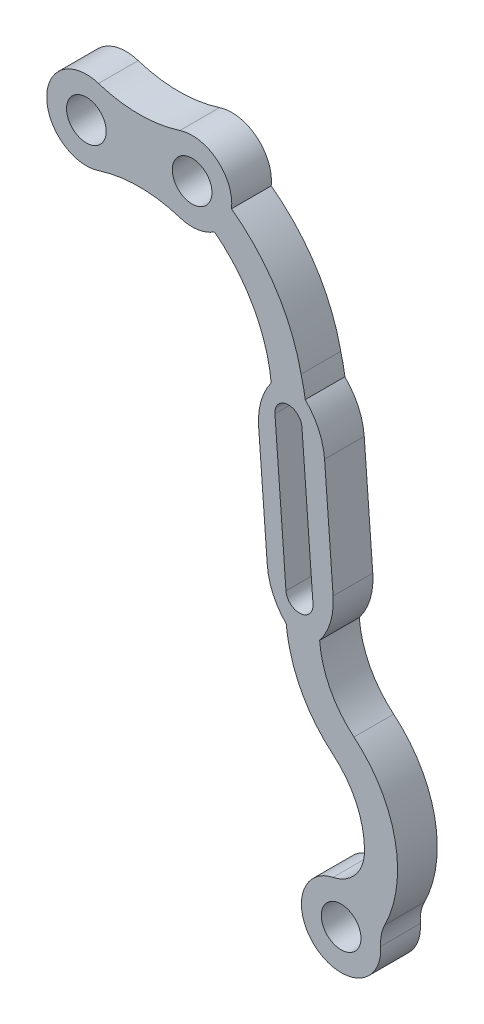
from build123d import *

# Parameters (mm, degrees)
BOSS_EXTRUDE1_OUTLINE_R = 1.5
BOSS_EXTRUDE1_DEPTH     = 3
FILLET1_R               = 5
CUT_EXTRUDE1_DEPTH      = 3


# Read off the part's stored shape, not the designer's step: Boss-Extrude1
with BuildPart() as part:
    # Boss-Extrude1 outline → Boss-Extrude1 (new body)
    with BuildSketch(Plane.XY):
        with BuildLine():
            ThreePointArc((-9.577975431, 41.29578544), (-7.088317742, 38.60475873), (-5.596455347, 35.255972867))
            add(Edge.make_bspline(
                [(-5.596455347, 35.255972867), (-5.582747417, 35.202444502), (-5.55529889, 35.095260217), (-5.517467472, 34.934551052), (-5.482131356, 34.775084793), (-5.449615345, 34.617937051), (-5.419947602, 34.464275495), (-5.393218029, 34.315238656), (-5.368054814, 34.162831666), (-5.344795736, 34.008181607), (-5.322858552, 33.847412998), (-5.30329297, 33.684837729), (-5.293582635, 33.591977311), (-5.288408722, 33.542498925)],
                knots=[0, 0, 0, 0, 0.07878117, 0.157750071, 0.236927243, 0.316333061, 0.395987726, 0.475911251, 0.556123446, 0.652047242, 0.7511991, 0.867432569, 1, 1, 1, 1], degree=3))
            Line((-5.288408722, 33.542498925), (-6.480466419, 33.453304935))
            Line((-6.480466419, 33.453304935), (-5.341603358, 18.232655185))
            Line((-5.341603358, 18.232655185), (-4.147731483, 18.321984917))
            ThreePointArc((-4.147731483, 18.321984917), (-4.032924942, 17.489163116), (-3.846988472, 16.66928488))
            ThreePointArc((-3.846988472, 16.66928488), (-2.642137665, 13.858181692), (-0.627607898, 11.55695671))
            ThreePointArc((-0.627607898, 11.55695671), (1.144975693, 9.256897759), (1.771644479, 6.421477156))
            ThreePointArc((1.771644479, 6.421477156), (1.098096567, 4.533436187), (-0.614174692, 3.491086617))
            ThreePointArc((-0.614174692, 3.491086617), (-1.806361188, -1.840587951), (2.992161355, 0.771354572))
            ThreePointArc((2.992161355, 0.771354572), (3.041722898, 1.572124284), (3.301741951, 2.331122684))
            ThreePointArc((3.301741951, 2.331122684), (4.077870779, 8.309876297), (0.972698011, 13.47763914))
            ThreePointArc((0.972698011, 13.47763914), (-0.835685645, 15.731138378), (-1.624382222, 18.510790869))
            Line((-1.624382222, 18.510790869), (-0.35554127, 18.605730055))
            Line((-0.35554127, 18.605730055), (-1.494404331, 33.826379806))
            Line((-1.494404331, 33.826379806), (-2.713176612, 33.735186936))
            add(Edge.make_bspline(
                [(-2.713176612, 33.735186936), (-2.713923066, 33.740199809), (-2.719747517, 33.779179521), (-2.737276775, 33.893529306), (-2.771774985, 34.097834296), (-2.823249297, 34.37037297), (-2.883340819, 34.657944683), (-2.950356176, 34.952197534), (-3.001326008, 35.14925666), (-3.026538809, 35.246734176)],
                knots=[0.162262456, 0.162262456, 0.162262456, 0.162262456, 0.173543134, 0.249389735, 0.406042985, 0.559353198, 0.709395257, 0.856249091, 1, 1, 1, 1], degree=3))
            ThreePointArc((-3.026538809, 35.246734176), (-4.904423993, 39.832081027), (-8.286103826, 43.453696691))
            ThreePointArc((-8.286103826, 43.453696691), (-9.376853546, 46.101850718), (-12.192055187, 46.62824831))
            ThreePointArc((-12.192055187, 46.62824831), (-15.268978264, 46.143107446), (-18.345901341, 46.62824831))
            ThreePointArc((-18.345901341, 46.62824831), (-22.268978264, 43.77379057), (-18.345901341, 40.919332829))
            ThreePointArc((-18.345901341, 40.919332829), (-15.268978264, 41.404473693), (-12.192055187, 40.919332829))
            ThreePointArc((-12.192055187, 40.919332829), (-10.841360803, 40.804423077), (-9.577975431, 41.29578544))
        make_face()
        with Locations((0, 0.55462796)):
            Circle(BOSS_EXTRUDE1_OUTLINE_R, mode=Mode.SUBTRACT)
        with Locations((-19.268978264, 43.773790569)):
            Circle(BOSS_EXTRUDE1_OUTLINE_R, mode=Mode.SUBTRACT)
        with Locations((-11.268978264, 43.773790569)):
            Circle(BOSS_EXTRUDE1_OUTLINE_R, mode=Mode.SUBTRACT)
    extrude(amount=BOSS_EXTRUDE1_DEPTH)

    # Fillet1
    # the kernel refuses this fillet: 5 mm, written as the material it takes off along each edge
    with BuildSketch(Plane(origin=(-6.480466419, 33.453304935, -8.110541878), x_dir=(0.9972124174989766, 0.07461497427357966, 0), z_dir=(0, 0, 1))) as fillet1_piece_1:
        with BuildLine():
            CenterArc((4.999999999, -3.244216752), FILLET1_R, 139.545547884, 40.454452104)
            Line((-1e-09, -3.244216751), (-0.100000001, -3.244216751))
            Line((-0.100000001, -3.244216751), (-0.1, 0))
            Line((-0.1, 0), (0, 0.1))
            ThreePointArc((0, 0.1), (0.597694973, 0.1), (1.119297744, 0.064884335))
            Line((1.119297744, 0.064884335), (1.195389945, 0))
        make_face()
    extrude(amount=19.221083756, mode=Mode.SUBTRACT)
    with BuildSketch(Plane(origin=(-1.494404331, 33.826379806, -8.188433173), x_dir=(0.07461497405549736, -0.9972124175152941, 0), z_dir=(0, 0, 1))) as fillet1_piece_2:
        with BuildLine():
            CenterArc((3.275373269, -5), FILLET1_R, 90, 40.925310843)
            Line((0, -1.222179206), (-0.065507465, -1.14662279))
            ThreePointArc((-0.065507465, -1.14662279), (-0.1, -0.611089603), (-0.1, 0))
            Line((-0.1, 0), (0, 0.1))
            Line((0, 0.1), (3.275373269, 0.1))
            Line((3.275373269, 0.1), (3.275373269, 0))
        make_face()
    extrude(amount=19.376866346, mode=Mode.SUBTRACT)
    with BuildSketch(Plane(origin=(-5.341603358, 18.232655185, -8.115872597), x_dir=(-0.07461497406037235, 0.9972124175149295, 0), z_dir=(0, 0, 1))) as fillet1_piece_3:
        with BuildLine():
            CenterArc((3.246349039, -5), FILLET1_R, 90, 40.486571122)
            Line((-1e-09, -1.197209194), (-0.064926982, -1.121153378))
            ThreePointArc((-0.064926982, -1.121153378), (-0.1, -0.598604597), (-0.1, 0))
            Line((-0.1, 0), (0, 0.1))
            Line((0, 0.1), (3.246349039, 0.1))
            Line((3.246349039, 0.1), (3.246349039, 0))
        make_face()
    extrude(amount=19.231745194, mode=Mode.SUBTRACT)
    with BuildSketch(Plane(origin=(-0.35554127, 18.605730055, -8.33100668), x_dir=(-0.9972124174875004, -0.07461497442695494, 0), z_dir=(0, 0, 1))) as fillet1_piece_4:
        with BuildLine():
            CenterArc((4.999999999, -3.332402674), FILLET1_R, 138.203991534, 41.796008444)
            Line((-1e-09, -3.332402672), (-0.100000001, -3.332402672))
            Line((-0.100000001, -3.332402672), (-0.1, 0))
            Line((-0.1, 0), (0, 0.1))
            ThreePointArc((0, 0.1), (0.636193919, 0.1), (1.197835595, 0.066648053))
            Line((1.197835595, 0.066648053), (1.272387838, 0))
        make_face()
    extrude(amount=19.662013359, mode=Mode.SUBTRACT)

    # Sketch2 → Cut-Extrude1 (cut)
    with BuildSketch(Plane(origin=(0, 0, 0), x_dir=(-1, 0, 0), z_dir=(0, 0, -1))):
        with BuildLine():
            Line((5.006415896, 31.658546167), (4.17027649, 20.483730275))
            ThreePointArc((4.17027649, 20.483730275), (3.071829301, 19.538219294), (2.12631832, 20.636666483))
            Line((2.12631832, 20.636666483), (2.962457726, 31.811482375))
            ThreePointArc((2.962457726, 31.811482375), (4.060904915, 32.756993356), (5.006415896, 31.658546167))
        make_face()
    extrude(amount=-CUT_EXTRUDE1_DEPTH, mode=Mode.SUBTRACT)


solid = part.part
